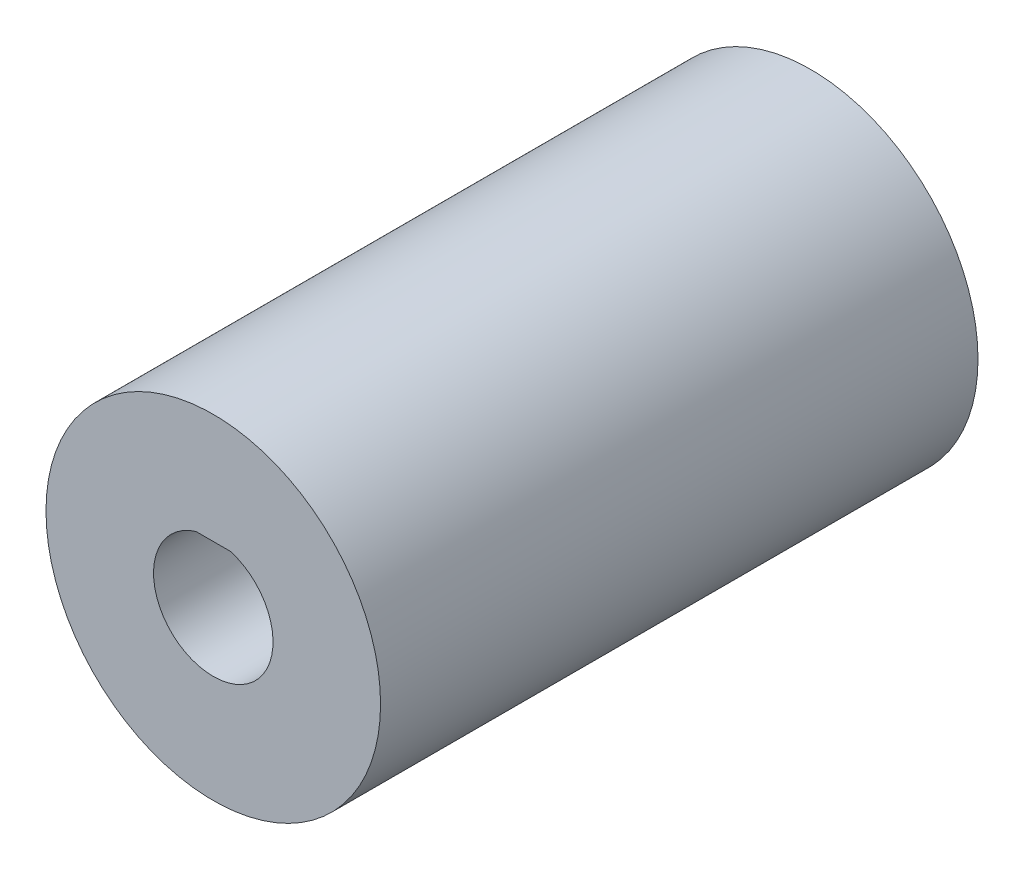
from build123d import *

# Parameters (mm, degrees)
SKETCH1_R           = 7
SKETCH1_R_2         = 3
BOSS_EXTRUDE1_DEPTH = 25
BOSS_EXTRUDE2_START = -10
SKETCH2_R           = 3
BOSS_EXTRUDE2_DEPTH = 10


with BuildPart() as part:
    # Sketch1 → Boss-Extrude1 (new body)
    with BuildSketch(Plane(origin=(0, 0, 0), x_dir=(0, 1, 0), z_dir=(0, 0, 1))):
        Circle(SKETCH1_R)
        Circle(SKETCH1_R_2, mode=Mode.SUBTRACT)
    extrude(amount=BOSS_EXTRUDE1_DEPTH)

    # Sketch2 → Boss-Extrude2 (add)
    with BuildSketch(Plane.XY.offset(25).offset(BOSS_EXTRUDE2_START)):
        Circle(SKETCH2_R)
        with BuildLine():
            Line((-0.728279445, 2.391570415), (0.728279445, 2.391570415))
            ThreePointArc((0.728279445, 2.391570415), (0, -2.5), (-0.728279445, 2.391570415))
        make_face(mode=Mode.SUBTRACT)
    extrude(amount=BOSS_EXTRUDE2_DEPTH)


solid = part.part
